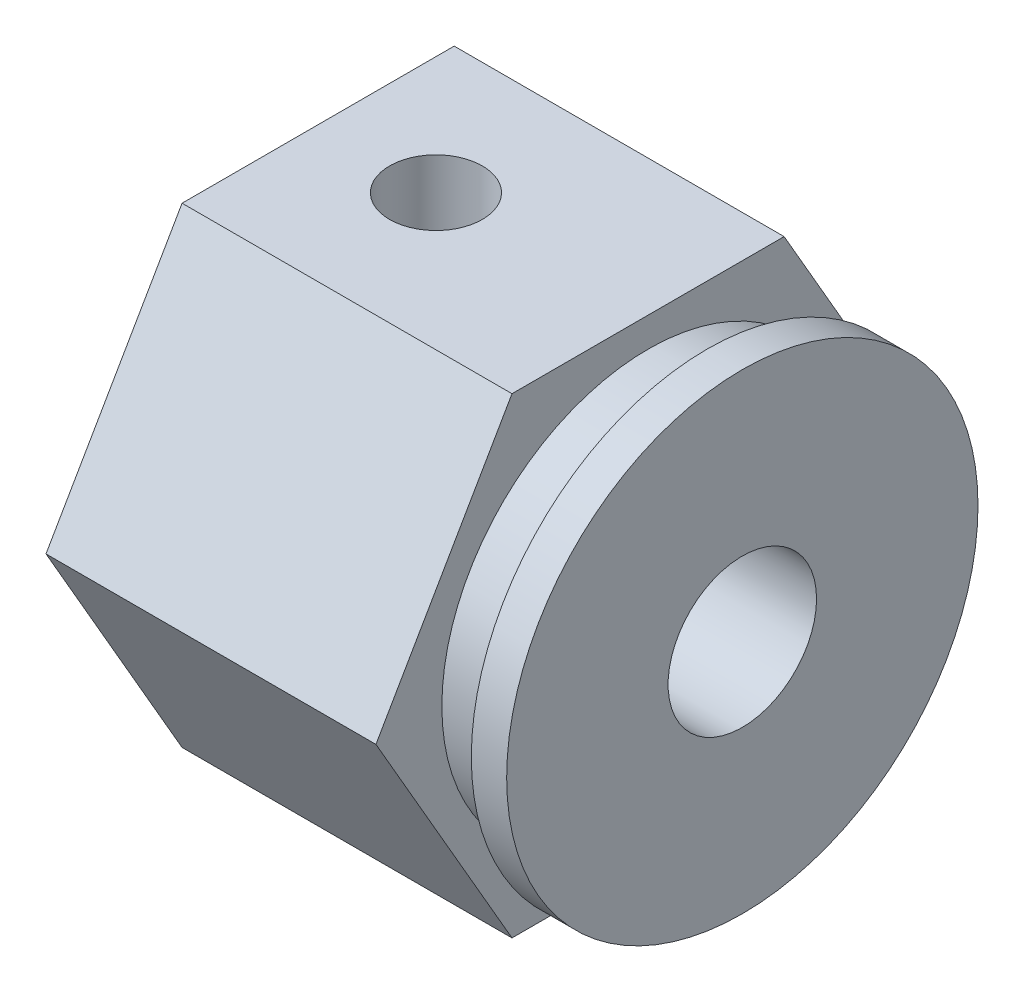
from build123d import *

# Parameters (mm, degrees)
BOSS_EXTRUDE1_DEPTH     = 8.89
SKETCH3_R               = 6.35
BOSS_EXTRUDE2_DEPTH     = 2.54
SKETCH4_W               = 1.5875
SKETCH4_H               = 0.79375
CUT_EXTRUDE1_REACH      = 16.991
SKETCH6_R               = 2
ADVANCEDHOLE1_START     = -6.35
ADVANCEDHOLE1_OUTLINE_R = 1.25
ADVANCEDHOLE1_DEPTH     = 12.7


# Read off the part's stored shape, not the designer's step: AdvancedHole1
with BuildPart() as part:
    # Sketch2 → Boss-Extrude1 (new body)
    with BuildSketch(Plane(origin=(0, 0, 0), x_dir=(0, 0, -1), z_dir=(1, 0, 0))):
        Polygon((7.332348419, 0), (3.666174209, 6.35), (-3.666174209, 6.35), (-7.332348419, 0), (-3.666174209, -6.35), (3.666174209, -6.35), align=None)
    extrude(amount=BOSS_EXTRUDE1_DEPTH)

    # Sketch3 → Boss-Extrude2 (add)
    with BuildSketch(Plane(origin=(8.89, 0, 0), x_dir=(0, 0, -1), z_dir=(1, 0, 0))):
        with Locations(Location((0, 0, 0), (0, 0, 150))):
            Circle(SKETCH3_R)
    extrude(amount=BOSS_EXTRUDE2_DEPTH)

    # Sketch4 → Cut-Revolve1 (revolve, cut)
    with BuildSketch(Plane.XY, mode=Mode.PRIVATE) as cut_revolve1_sk:
        with Locations((9.68375, 5.953125)):
            Rectangle(SKETCH4_W, SKETCH4_H)
    revolve(cut_revolve1_sk.sketch.rotate(Axis((0, 0, 0), (1, 0, 0)), 90), axis=Axis((0, 0, 0), (1, 0, 0)), mode=Mode.SUBTRACT)

    # Sketch6 → Cut-Extrude1 (cut, up to next)
    with BuildSketch(Plane(origin=(11.43, 0, 0), x_dir=(0, 0, -1), z_dir=(1, 0, 0)), mode=Mode.PRIVATE) as cut_extrude1_sk1:
        Circle(SKETCH6_R)
    cut_extrude1_tool1 = extrude(cut_extrude1_sk1.sketch, amount=-CUT_EXTRUDE1_REACH, mode=Mode.PRIVATE) & part.part
    add(cut_extrude1_tool1.solids().sort_by_distance((11.43, 0, 0))[0], mode=Mode.SUBTRACT)

    # AdvancedHole1 outline → AdvancedHole1 (cut)
    with BuildSketch(Plane(origin=(0, 0, 0), x_dir=(1, 0, 0), z_dir=(0, 1, 0)).offset(ADVANCEDHOLE1_START)):
        with Locations((3.175, 0)):
            Circle(ADVANCEDHOLE1_OUTLINE_R)
    extrude(amount=ADVANCEDHOLE1_DEPTH, mode=Mode.SUBTRACT)


solid = part.part
